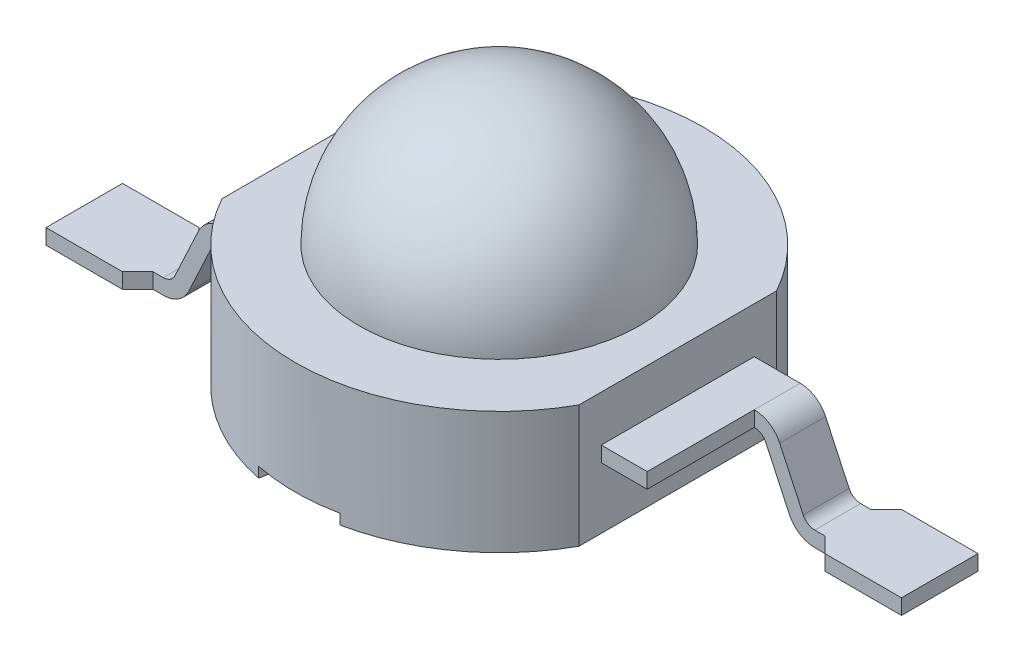
from build123d import *

# Parameters (mm, degrees)
BOSS_EXTRUDE1_DEPTH = 2.4
SKETCH2_R           = 2.75
BOSS_EXTRUDE2_DEPTH = 0.25
SKETCH3_R           = 2
BOSS_EXTRUDE3_DEPTH = 0.3
SKETCH5_W           = 8.3
SKETCH5_H           = 3
BOSS_EXTRUDE4_DEPTH = 0.15
SKETCH6_W           = 0.9
SKETCH6_H           = 0.3
SKETCH8_W           = 0.9
SKETCH8_H           = 0.3
SKETCH10_W          = 1.5
SKETCH10_H          = 0.3
BOSS_EXTRUDE5_DEPTH = 1.8
SKETCH11_W          = 1.5
SKETCH11_H          = 0.3
BOSS_EXTRUDE6_DEPTH = 1.8
CHAMFER1_SIZE       = 0.3
SKETCH12_R          = 0.8
CUT_EXTRUDE1_DEPTH  = 0.2


with BuildPart() as part:
    # Sketch1 → Boss-Extrude1 (new body)
    with BuildSketch(Plane(origin=(0, 0, 0), x_dir=(1, 0, 0), z_dir=(0, 1, 0))):
        with BuildLine():
            Line((-3.5, 1.936491673), (-3.5, -1.936491673))
            ThreePointArc((-3.5, -1.936491673), (0, -4), (3.5, -1.936491673))
            Line((3.5, -1.936491673), (3.5, 1.936491673))
            ThreePointArc((3.5, 1.936491673), (0, 4), (-3.5, 1.936491673))
        make_face()
    extrude(amount=BOSS_EXTRUDE1_DEPTH)

    # Sketch2 → Boss-Extrude2 (add)
    with BuildSketch(Plane(origin=(0, 0, 0), x_dir=(1, 0, 0), z_dir=(0, 1, 0))):
        with Locations(Location((0, 0, 0), (0, 0, 270))):
            Circle(SKETCH2_R)
    extrude(amount=-BOSS_EXTRUDE2_DEPTH)

    # Sketch3 → Boss-Extrude3 (add)
    with BuildSketch(Plane(origin=(0, 2.4, 0), x_dir=(1, 0, 0), z_dir=(0, 1, 0))):
        with Locations(Location((0, 0, 0), (0, 0, 270))):
            Circle(SKETCH3_R)
    extrude(amount=BOSS_EXTRUDE3_DEPTH)

    # Sketch5 → Boss-Extrude4 (add, symmetric)
    with BuildSketch(Plane(origin=(0, 1.35, 0), x_dir=(-1, 0, 0), z_dir=(0, 1, 0))):
        with Locations((-0.25, 0)):
            Rectangle(SKETCH5_W, SKETCH5_H)
    extrude(amount=BOSS_EXTRUDE4_DEPTH, both=True)

    # Sweep2: sweep along a path in Sketch7
    with BuildLine(Plane.XY.offset(-1.05)) as sweep2_path:
        Line((5.785802313, -0.1), (5.585802313, -0.1))
        ThreePointArc((5.585802313, -0.1), (5.37088247, -0.037356578), (5.223279198, 0.130952695))
        Line((5.223279198, 0.130952695), (4.762523115, 1.119047305))
        ThreePointArc((4.762523115, 1.119047305), (4.614919843, 1.287356578), (4.4, 1.35))
    # Sketch6 → Sweep2 (sweep)
    with BuildSketch(Plane(origin=(4.4, 0, 0), x_dir=(0, 0, -1), z_dir=(1, 0, 0))):
        with Locations((1.05, 1.35)):
            Rectangle(SKETCH6_W, SKETCH6_H)
    sweep(path=sweep2_path.line)

    # Sweep3: sweep along a path in Sketch9
    with BuildLine(Plane.XY.offset(1.05)) as sweep3_path:
        Line((-5.285802313, -0.1), (-5.085802313, -0.1))
        ThreePointArc((-5.085802313, -0.1), (-4.87088247, -0.037356578), (-4.723279198, 0.130952695))
        Line((-4.723279198, 0.130952695), (-4.262523115, 1.119047305))
        ThreePointArc((-4.262523115, 1.119047305), (-4.114919843, 1.287356578), (-3.9, 1.35))
    # Sketch8 → Sweep3 (sweep)
    with BuildSketch(Plane.ZY.offset(3.9)):
        with Locations((1.05, 1.35)):
            Rectangle(SKETCH8_W, SKETCH8_H)
    sweep(path=sweep3_path.line)

    # Sketch10 → Boss-Extrude5 (add)
    with BuildSketch(Plane.ZY.offset(5.285802313)):
        with Locations((1.05, -0.1)):
            Rectangle(SKETCH10_W, SKETCH10_H)
    extrude(amount=BOSS_EXTRUDE5_DEPTH)

    # Sketch11 → Boss-Extrude6 (add)
    with BuildSketch(Plane(origin=(5.785802313, 0, 0), x_dir=(0, 0, -1), z_dir=(1, 0, 0))):
        with Locations((1.05, -0.1)):
            Rectangle(SKETCH11_W, SKETCH11_H)
    extrude(amount=BOSS_EXTRUDE6_DEPTH)

    # Chamfer1
    chamfer1_edges = [part.edges().sort_by_distance(p)[0] for p in [
        (5.785802313, -0.1, -0.3),
        (5.785802313, -0.1, -1.8),
        (-5.285802313, -0.1, 0.3),
        (-5.285802313, -0.1, 1.8),
    ]]
    chamfer(chamfer1_edges, length=CHAMFER1_SIZE - 0.0001)  # a hair under: the kernel refuses the full size

    # Sketch12 → Cut-Extrude1 (cut)
    with BuildSketch(Plane.XZ):
        with Locations((0, 4)):
            Circle(SKETCH12_R)
        with Locations((0, -4)):
            Circle(SKETCH12_R)
    extrude(amount=-CUT_EXTRUDE1_DEPTH, mode=Mode.SUBTRACT)


with BuildPart() as body_2:
    # Sketch4 → Revolve1 (revolve)
    with BuildSketch(Plane.XY):
        with BuildLine():
            Line((0, 2.4), (0, 5.15))
            ThreePointArc((0, 5.15), (1.944543648, 4.344543648), (2.75, 2.4))
            Line((2.75, 2.4), (0, 2.4))
        make_face()
    revolve(axis=Axis((0, 2.4, 0), (0, 1, 0)))


solid = Compound([part.part, body_2.part])
